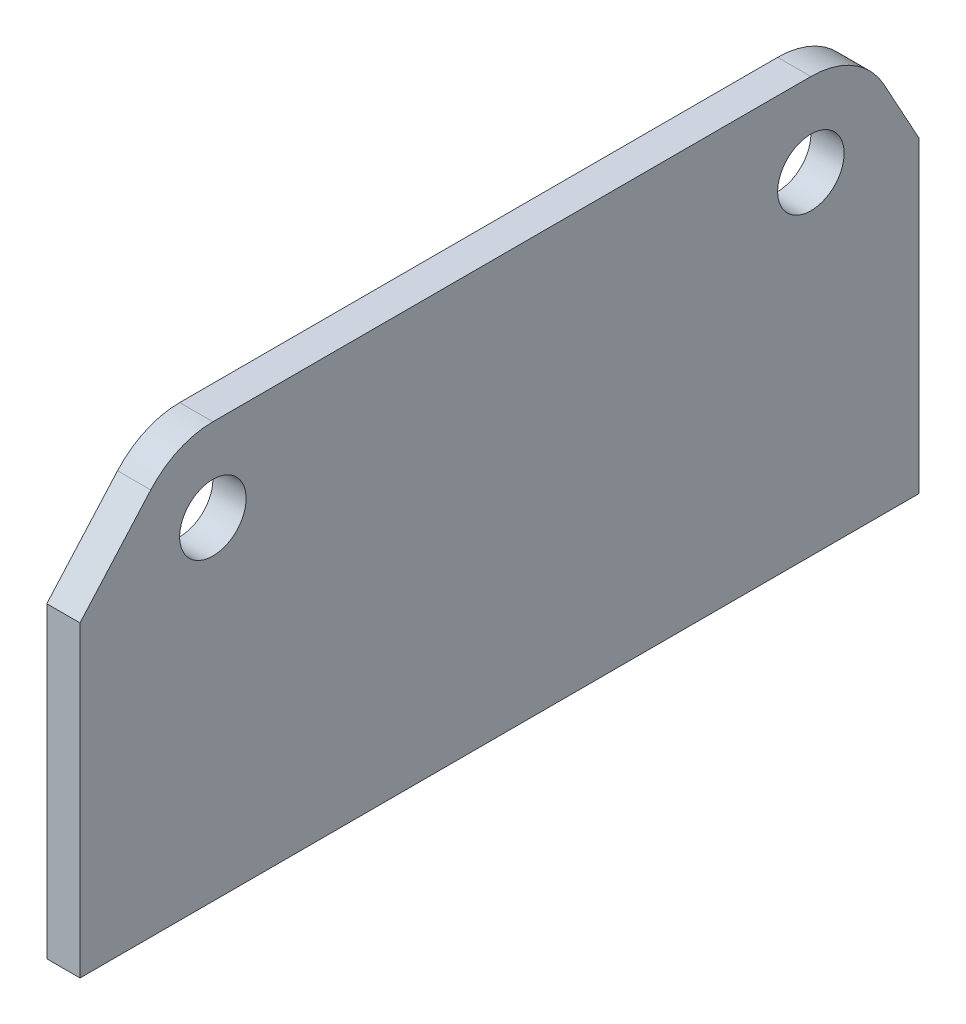
from build123d import *

# Parameters (mm, degrees)
SKETCH1_W           = 558.8
SKETCH1_H           = 88.9
BOSS_EXTRUDE1_DEPTH = 12.7
SKETCH2_R           = 12.7
BOSS_EXTRUDE2_DEPTH = 12.7
BOSS_EXTRUDE3_DEPTH = 12.7
CUT_EXTRUDE1_DEPTH  = 339.909706081
CUT_EXTRUDE2_DEPTH  = 339.909706081


with BuildPart() as part:
    # Sketch1 → Boss-Extrude1 (new body)
    with BuildSketch(Plane(origin=(0, 0, 0), x_dir=(0, 0, -1), z_dir=(1, 0, 0))):
        Rectangle(SKETCH1_W, SKETCH1_H)
    extrude(amount=BOSS_EXTRUDE1_DEPTH)

    # Sketch2 → Boss-Extrude2 (add)
    with BuildSketch(Plane(origin=(12.7, 0, 0), x_dir=(0, 0, -1), z_dir=(1, 0, 0))):
        with BuildLine():
            Line((-226.959477075, 103.610620816), (-279.4, 44.45))
            Line((-279.4, 44.45), (82.55, 44.45))
            Line((82.55, 44.45), (53.228733422, 97.8347668))
            ThreePointArc((53.228733422, 97.8347668), (41.567423328, 109.875389713), (25.4, 114.3))
            Line((25.4, 114.3), (-203.2, 114.3))
            ThreePointArc((-203.2, 114.3), (-216.226660913, 111.504595584), (-226.959477075, 103.610620816))
        make_face()
        with Locations((-203.2, 82.55)):
            Circle(SKETCH2_R, mode=Mode.SUBTRACT)
        with Locations((25.4, 82.55)):
            Circle(SKETCH2_R, mode=Mode.SUBTRACT)
    extrude(amount=-BOSS_EXTRUDE2_DEPTH)

    # Sketch3 → Boss-Extrude3 (add)
    with BuildSketch(Plane(origin=(12.7, 0, 0), x_dir=(0, 0, -1), z_dir=(1, 0, 0))):
        Polygon((-279.4, -44.45), (-318.800892213, 0), (-279.4, 44.45), align=None)
    extrude(amount=-BOSS_EXTRUDE3_DEPTH)

    # Sketch4 → Cut-Extrude1 (cut, through all)
    with BuildSketch(Plane(origin=(12.7, 0, 0), x_dir=(0, 0, -1), z_dir=(1, 0, 0))):
        Polygon((82.55, 44.45), (106.963898899, 0), (82.55, -44.45), (279.4, -44.45), (279.4, 44.45), align=None)
    extrude(amount=-CUT_EXTRUDE1_DEPTH, mode=Mode.SUBTRACT)

    # Sketch5 → Cut-Extrude2 (cut, through all)
    with BuildSketch(Plane(origin=(12.7, 0, 0), x_dir=(0, 0, -1), z_dir=(1, 0, 0))):
        Polygon((-254, -44.45), (-254, 73.104934865), (-318.800892213, 0), (-279.4, -44.45), align=None)
        Polygon((66.811446957, 73.104934865), (66.811446957, -44.45), (82.55, -44.45), (106.963898899, 0), align=None)
    extrude(amount=-CUT_EXTRUDE2_DEPTH, mode=Mode.SUBTRACT)


solid = part.part
